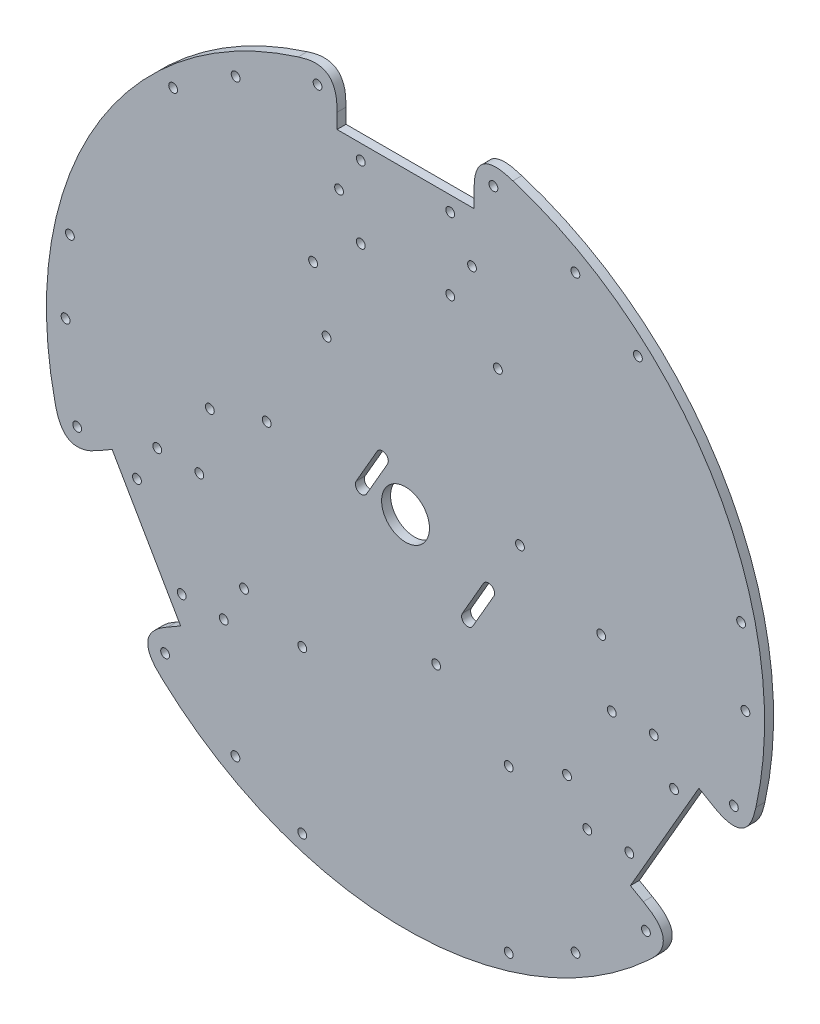
from build123d import *

# Parameters (mm, degrees)
SKETCH1_R           = 1.475
SKETCH1_R_2         = 8
BOSS_EXTRUDE1_DEPTH = 3
FILLET1_START       = -1
FILLET1_DEPTH       = 5
SKETCH2_R           = 1.475
CUT_EXTRUDE1_DEPTH  = 186.540999332


with BuildPart() as part:
    # Sketch1 → Boss-Extrude1 (new body)
    with BuildSketch(Plane.XY):
        with BuildLine():
            Line((0.526015848, 103.328982943), (-45.247486844, 103.328982943))
            Line((-45.247486844, 103.328982943), (-45.247486844, 121.128982943))
            ThreePointArc((-45.247486844, 121.128982943), (-126.28610555, 63.330323318), (-135.821903737, -35.750508981))
            Line((-135.821903737, -35.750508981), (-120.406651549, -26.850508981))
            Line((-120.406651549, -26.850508981), (-97.519900204, -66.491525133))
            Line((-97.519900204, -66.491525133), (-112.935152391, -75.391525133))
            ThreePointArc((-112.935152391, -75.391525133), (-22.360735498, -116.673697807), (68.213681395, -75.391525133))
            Line((68.213681395, -75.391525133), (52.798429207, -66.491525133))
            Line((52.798429207, -66.491525133), (75.685180553, -26.850508981))
            Line((75.685180553, -26.850508981), (91.100432741, -35.750508981))
            ThreePointArc((91.100432741, -35.750508981), (81.564634554, 63.330323318), (0.526015848, 121.128982943))
            Line((0.526015848, 121.128982943), (0.526015848, 103.328982943))
        make_face()
        with Locations((67.384177861, -31.228267397)):
            Circle(SKETCH1_R, mode=Mode.SUBTRACT)
        with Locations((52.439177861, -57.113766716)):
            Circle(SKETCH1_R, mode=Mode.SUBTRACT)
        with Locations((-97.160648858, -57.113766716)):
            Circle(SKETCH1_R, mode=Mode.SUBTRACT)
        with Locations((-56.860735498, -106.258884513)):
            Circle(SKETCH1_R, mode=Mode.SUBTRACT)
        with Locations((-112.105648858, -31.228267397)):
            Circle(SKETCH1_R, mode=Mode.SUBTRACT)
        with Locations((-91.269077643, -19.198267397)):
            Circle(SKETCH1_R, mode=Mode.SUBTRACT)
        with Locations((-76.324077643, -45.083766716)):
            Circle(SKETCH1_R, mode=Mode.SUBTRACT)
        with Locations((-56.860735498, -52.258884513)):
            Circle(SKETCH1_R, mode=Mode.SUBTRACT)
        with Locations((12.139264502, -106.258884513)):
            Circle(SKETCH1_R, mode=Mode.SUBTRACT)
        with Locations((-12.112024192, -34.919728363)):
            Circle(SKETCH1_R, mode=Mode.SUBTRACT)
        with Locations((12.139264502, -52.258884513)):
            Circle(SKETCH1_R, mode=Mode.SUBTRACT)
        with Locations((31.602606646, -45.083766716)):
            Circle(SKETCH1_R, mode=Mode.SUBTRACT)
        with BuildLine():
            ThreePointArc((0.120026615, -17.733194883), (-1.094386102, -18.665046536), (-2.612024192, -18.465245691))
            ThreePointArc((-2.612024192, -18.465245691), (-3.543875845, -17.250832974), (-3.344075, -15.733194883))
            Line((-3.344075, -15.733194883), (3.655925, -3.60883923))
            ThreePointArc((3.655925, -3.60883923), (4.870337718, -2.676987578), (6.387975808, -2.876788423))
            ThreePointArc((6.387975808, -2.876788423), (7.31982746, -4.09120114), (7.120026615, -5.60883923))
            Line((7.120026615, -5.60883923), (0.120026615, -17.733194883))
        make_face(mode=Mode.SUBTRACT)
        with Locations((46.547606646, -19.198267397)):
            Circle(SKETCH1_R, mode=Mode.SUBTRACT)
        with Locations((-87.751240857, 1.245040241)):
            Circle(SKETCH1_R, mode=Mode.SUBTRACT)
        with Locations((-134.516612662, 28.245040241)):
            Circle(SKETCH1_R, mode=Mode.SUBTRACT)
        with Locations((-68.733802457, 7.008474867)):
            Circle(SKETCH1_R, mode=Mode.SUBTRACT)
        with BuildLine():
            Line((-28.38701494, 14.89116077), (-35.38701494, 2.766805117))
            ThreePointArc((-35.38701494, 2.766805117), (-38.119065747, 2.034754309), (-38.851116555, 4.766805117))
            Line((-38.851116555, 4.766805117), (-31.851116555, 16.89116077))
            ThreePointArc((-31.851116555, 16.89116077), (-29.119065747, 17.623211577), (-28.38701494, 14.89116077))
        make_face(mode=Mode.SUBTRACT)
        with Locations((-48.733802457, 41.649491019)):
            Circle(SKETCH1_R, mode=Mode.SUBTRACT)
        with Locations((-100.016612662, 88.000793102)):
            Circle(SKETCH1_R, mode=Mode.SUBTRACT)
        with Locations((-53.251240857, 61.000793102)):
            Circle(SKETCH1_R, mode=Mode.SUBTRACT)
        with Locations((-37.305735498, 74.268982943)):
            Circle(SKETCH1_R, mode=Mode.SUBTRACT)
        with Locations((-37.305735498, 98.328982943)):
            Circle(SKETCH1_R, mode=Mode.SUBTRACT)
        with Locations((-22.360735498, 3.328982943)):
            Circle(SKETCH1_R_2, mode=Mode.SUBTRACT)
        with Locations((15.887975808, 13.577694249)):
            Circle(SKETCH1_R, mode=Mode.SUBTRACT)
        with Locations((43.029769861, 1.245040241)):
            Circle(SKETCH1_R, mode=Mode.SUBTRACT)
        with Locations((89.795141666, 28.245040241)):
            Circle(SKETCH1_R, mode=Mode.SUBTRACT)
        with Locations((8.529769861, 61.000793102)):
            Circle(SKETCH1_R, mode=Mode.SUBTRACT)
        with Locations((-7.415735498, 74.268982943)):
            Circle(SKETCH1_R, mode=Mode.SUBTRACT)
        with Locations((-7.415735498, 98.328982943)):
            Circle(SKETCH1_R, mode=Mode.SUBTRACT)
        with Locations((55.295141666, 88.000793102)):
            Circle(SKETCH1_R, mode=Mode.SUBTRACT)
    extrude(amount=BOSS_EXTRUDE1_DEPTH)

    # Fillet1: read off the stored shape, not the designer's step
    # Fillet1 outline → Fillet1 (cut)
    with BuildSketch(Plane.XY.offset(FILLET1_START)):
        with BuildLine():
            ThreePointArc((-45.247486844, 121.128982943), (-51.788195876, 119.667574833), (-58.237118653, 117.843298724))
            add(Edge.make_bspline(
                [(-58.237118653, 117.843298724), (-56.095583294, 118.514223949), (-53.982026531, 119.121408989), (-49.353840332, 119.42067321), (-46.388701083, 117.326670501), (-45.247486844, 112.620410582), (-45.247486844, 110.460531419), (-45.247486844, 108.300652255)],
                knots=[0, 0, 0, 0, 0, 0, 0.5, 0.5, 1, 1, 1, 1, 1, 1], degree=5))
            Line((-45.247486844, 108.300652255), (-45.247486844, 121.128982943))
        make_face()
        with BuildLine():
            add(Edge.make_bspline(
                [(-124.712243473, -29.336343637), (-126.582753698, -30.416283219), (-128.453263923, -31.496222801), (-133.099611688, -32.861032238), (-136.395640855, -31.340147677), (-138.450563536, -27.182388745), (-138.981504249, -25.048402376), (-139.471233639, -22.858315739)],
                knots=[0, 0, 0, 0, 0, 0, 0.5, 0.5, 1, 1, 1, 1, 1, 1], degree=5))
            ThreePointArc((-139.471233639, -22.858315739), (-137.826641704, -29.355384745), (-135.821903737, -35.750508981))
            Line((-135.821903737, -35.750508981), (-124.712243473, -29.336343637))
        make_face()
        with BuildLine():
            ThreePointArc((91.100432741, -35.750508981), (93.105170708, -29.355384745), (94.749762643, -22.858315739))
            add(Edge.make_bspline(
                [(94.749762643, -22.858315739), (94.260033253, -25.048402376), (93.72909254, -27.182388745), (91.674169859, -31.340147677), (88.378140692, -32.861032238), (83.731792926, -31.496222801), (81.861282701, -30.416283219), (79.990772476, -29.336343637)],
                knots=[0, 0, 0, 0, 0, 0, 0.5, 0.5, 1, 1, 1, 1, 1, 1], degree=5))
            Line((79.990772476, -29.336343637), (91.100432741, -35.750508981))
        make_face()
        with BuildLine():
            Line((0.526015848, 121.128982943), (0.526015848, 108.300652255))
            add(Edge.make_bspline(
                [(0.526015848, 108.300652255), (0.526015848, 110.460531419), (0.526015848, 112.620410582), (1.667230086, 117.326670501), (4.632369336, 119.42067321), (9.260555535, 119.121408989), (11.374112298, 118.514223949), (13.515647657, 117.843298724)],
                knots=[0, 0, 0, 0, 0, 0, 0.5, 0.5, 1, 1, 1, 1, 1, 1], degree=5))
            ThreePointArc((13.515647657, 117.843298724), (7.06672488, 119.667574833), (0.526015848, 121.128982943))
        make_face()
        with BuildLine():
            ThreePointArc((-112.935152391, -75.391525133), (-108.399181326, -80.325241258), (-103.594850484, -84.998034156))
            add(Edge.make_bspline(
                [(-103.594850484, -84.998034156), (-105.246656452, -83.478872744), (-106.829272503, -81.952071414), (-109.402536021, -78.093576704), (-109.071646103, -74.478689433), (-105.566512577, -71.137238952), (-103.696002352, -70.05729937), (-101.825492127, -68.977359788)],
                knots=[0, 0, 0, 0, 0, 0, 0.5, 0.5, 1, 1, 1, 1, 1, 1], degree=5))
            Line((-101.825492127, -68.977359788), (-112.935152391, -75.391525133))
        make_face()
        with BuildLine():
            Line((68.213681395, -75.391525133), (57.104021131, -68.977359788))
            add(Edge.make_bspline(
                [(57.104021131, -68.977359788), (58.974531355, -70.05729937), (60.84504158, -71.137238952), (64.350175107, -74.478689433), (64.681065025, -78.093576704), (62.107801507, -81.952071414), (60.525185456, -83.478872744), (58.873379488, -84.998034156)],
                knots=[0, 0, 0, 0, 0, 0, 0.5, 0.5, 1, 1, 1, 1, 1, 1], degree=5))
            ThreePointArc((58.873379488, -84.998034156), (63.67771033, -80.325241258), (68.213681395, -75.391525133))
        make_face()
    extrude(amount=FILLET1_DEPTH, mode=Mode.SUBTRACT)

    # Sketch2 → Cut-Extrude1 (cut, through all)
    with BuildSketch(Plane.XY.offset(3)):
        with Locations((7.020831752, 113.07197549)):
            Circle(SKETCH2_R)
        with Locations((-51.742302749, 113.07197549)):
            Circle(SKETCH2_R)
        with Locations((-79.127551915, 101.737973696)):
            Circle(SKETCH2_R)
        with Locations((34.406080919, 101.737973696)):
            Circle(SKETCH2_R)
        with Locations((-0.147120048, 86.298982943)):
            Circle(SKETCH2_R)
        with Locations((-44.574350948, 86.298982943)):
            Circle(SKETCH2_R)
        with Locations((91.247358663, 3.285992676)):
            Circle(SKETCH2_R)
        with Locations((87.37026756, -26.097329688)):
            Circle(SKETCH2_R)
        with Locations((60.600199979, -18.918461767)):
            Circle(SKETCH2_R)
        with Locations((38.386584529, -57.393572347)):
            Circle(SKETCH2_R)
        with Locations((34.480542246, -95.037017543)):
            Circle(SKETCH2_R)
        with Locations((57.988700309, -76.987696972)):
            Circle(SKETCH2_R)
        with Locations((-79.202013242, -95.037017543)):
            Circle(SKETCH2_R)
        with Locations((-102.710171305, -76.987696972)):
            Circle(SKETCH2_R)
        with Locations((-83.108055525, -57.393572347)):
            Circle(SKETCH2_R)
        with Locations((-132.091738556, -26.097329688)):
            Circle(SKETCH2_R)
        with Locations((-105.321670975, -18.918461767)):
            Circle(SKETCH2_R)
        with Locations((-135.96882966, 3.285992676)):
            Circle(SKETCH2_R)
    extrude(amount=-CUT_EXTRUDE1_DEPTH, mode=Mode.SUBTRACT)


solid = part.part
